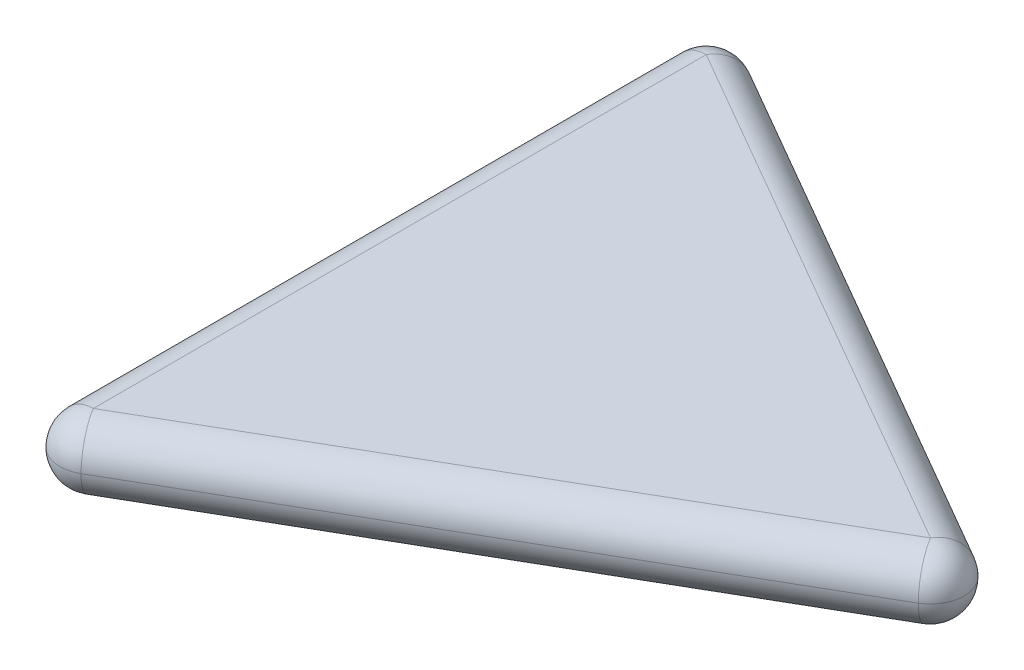
from build123d import *

# Parameters (mm, degrees)
BOSS_EXTRUDE1_DEPTH        = 20
BOSS_EXTRUDE1_DEPTH_BACK   = 20
SKETCH1_R                  = 9.5041e-05
BOSS_EXTRUDE1_2_DEPTH      = 20
BOSS_EXTRUDE1_2_DEPTH_BACK = 20
FILLET1_R                  = 20


with BuildPart() as part:
    # Sketch1 → Boss-Extrude1 (new, two sides: drawn at the far end of the back side and taken through both)
    with BuildSketch(Plane(origin=(0, 0, 0), x_dir=(1, 0, 0), z_dir=(0, 1, 0)).offset(-BOSS_EXTRUDE1_DEPTH_BACK)):
        with Locations(Location((250.94, 0, 0), (0, 0, 270))):
            Circle(SKETCH1_R)
    extrude(amount=BOSS_EXTRUDE1_DEPTH + BOSS_EXTRUDE1_DEPTH_BACK)


with BuildPart() as body_2:
    # Sketch1 → Boss-Extrude1 2 (new, two sides: drawn at the far end of the back side and taken through both)
    with BuildSketch(Plane(origin=(0, 0, 0), x_dir=(1, 0, 0), z_dir=(0, 1, 0)).offset(-BOSS_EXTRUDE1_2_DEPTH_BACK)):
        with BuildLine():
            Line((220.94, 17.320508076), (-95.47, 199.99990675))
            ThreePointArc((-95.47, 199.99990675), (-115.47, 199.99990675), (-125.47, 182.679398674))
            Line((-125.47, 182.679398674), (-125.47, -182.679398674))
            ThreePointArc((-125.47, -182.679398674), (-115.47, -199.99990675), (-95.47, -199.99990675))
            Line((-95.47, -199.99990675), (220.94, -17.320508076))
            ThreePointArc((220.94, -17.320508076), (230.94, 0), (220.94, 17.320508076))
        make_face()
    extrude(amount=BOSS_EXTRUDE1_2_DEPTH + BOSS_EXTRUDE1_2_DEPTH_BACK)

    # Fillet1
    fillet1_edges = [body_2.edges().sort_by_distance(p)[0] for p in [
        (-125.47, -20, 0),
        (-115.47, -20, 199.99990675),
        (62.735, -20, 108.660207413),
        (230.94, -20, 0),
        (62.735, -20, -108.660207413),
        (-115.47, -20, -199.99990675),
        (-115.47, 20, -199.99990675),
        (62.735, 20, -108.660207413),
        (230.94, 20, 0),
        (62.735, 20, 108.660207413),
        (-115.47, 20, 199.99990675),
        (-125.47, 20, 0),
    ]]
    fillet(fillet1_edges, radius=FILLET1_R - 0.0001)  # a hair under: the kernel refuses the full size


solid = body_2.part
